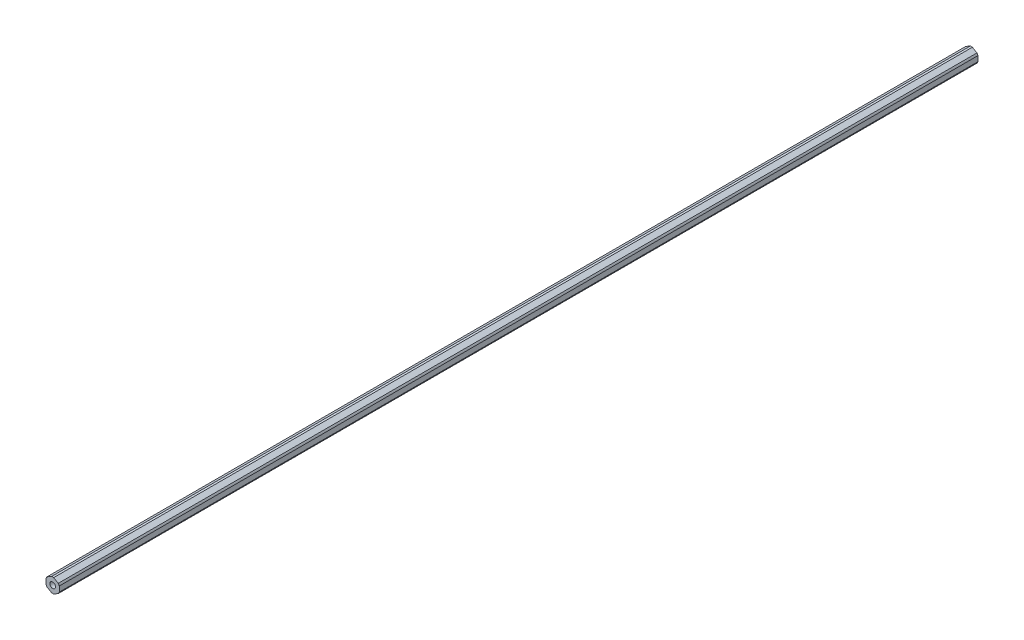
from build123d import *

# Parameters (mm, degrees)
SKETCH2_R                            = 2.0193
BOSS_EXTRUDE1_DEPTH                  = 328.865099952
F_10_32_TAPPED_HOLE2_D               = 4.0386
F_10_32_TAPPED_HOLE2_DEPTH           = 16.34744
F_10_32_TAPPED_HOLE2_TIP             = 1.213317848
F_10_32_TAPPED_HOLE2_ON_FACE_2_D     = 4.0386
F_10_32_TAPPED_HOLE2_ON_FACE_2_DEPTH = 16.34744
F_10_32_TAPPED_HOLE2_ON_FACE_2_TIP   = 1.213317848


with BuildPart() as part:
    # Sketch2 → Boss-Extrude1 (new, symmetric)
    with BuildSketch(Plane.XY):
        with BuildLine():
            ThreePointArc((0.741687758, 5.071047688), (0, 5.125000037), (-0.741687758, 5.071047688))
            Line((-0.741687758, 5.071047688), (-4.020812242, 3.177844283))
            ThreePointArc((-4.020812242, 3.177844283), (-4.438380226, 2.562500019), (-4.7625, 1.893203404))
            Line((-4.7625, 1.893203404), (-4.7625, -1.893203404))
            ThreePointArc((-4.7625, -1.893203404), (-4.438380226, -2.562500019), (-4.020812242, -3.177844283))
            Line((-4.020812242, -3.177844283), (-0.741687758, -5.071047688))
            ThreePointArc((-0.741687758, -5.071047688), (0, -5.125000037), (0.741687758, -5.071047688))
            Line((0.741687758, -5.071047688), (4.020812242, -3.177844283))
            ThreePointArc((4.020812242, -3.177844283), (4.438380226, -2.562500019), (4.7625, -1.893203404))
            Line((4.7625, -1.893203404), (4.7625, 1.893203404))
            ThreePointArc((4.7625, 1.893203404), (4.438380226, 2.562500019), (4.020812242, 3.177844283))
            Line((4.020812242, 3.177844283), (0.741687758, 5.071047688))
        make_face()
        Circle(SKETCH2_R, mode=Mode.SUBTRACT)
    extrude(amount=BOSS_EXTRUDE1_DEPTH, both=True)

    # #10-32 Tapped Hole2
    with Locations(Plane(origin=(0, 0, -328.865099952), x_dir=(-1, 0, 0), z_dir=(0, 0, -1))):
        with Locations((0, 0)):
            Hole(F_10_32_TAPPED_HOLE2_D / 2, depth=F_10_32_TAPPED_HOLE2_DEPTH)
            with Locations((0, 0, -(F_10_32_TAPPED_HOLE2_DEPTH + F_10_32_TAPPED_HOLE2_TIP / 2))):  # 118° drill point
                Cone(0, F_10_32_TAPPED_HOLE2_D / 2, F_10_32_TAPPED_HOLE2_TIP, mode=Mode.SUBTRACT)

    # #10-32 Tapped Hole2 on face 2
    with Locations(Plane(origin=(0, 0, 328.865099952), x_dir=(-1, 0, 0), z_dir=(0, 0, -1))):
        with Locations((0, 0)):
            Hole(F_10_32_TAPPED_HOLE2_ON_FACE_2_D / 2, depth=F_10_32_TAPPED_HOLE2_ON_FACE_2_DEPTH)
            with Locations((0, 0, -(F_10_32_TAPPED_HOLE2_ON_FACE_2_DEPTH + F_10_32_TAPPED_HOLE2_ON_FACE_2_TIP / 2))):  # 118° drill point
                Cone(0, F_10_32_TAPPED_HOLE2_ON_FACE_2_D / 2, F_10_32_TAPPED_HOLE2_ON_FACE_2_TIP, mode=Mode.SUBTRACT)


solid = part.part
